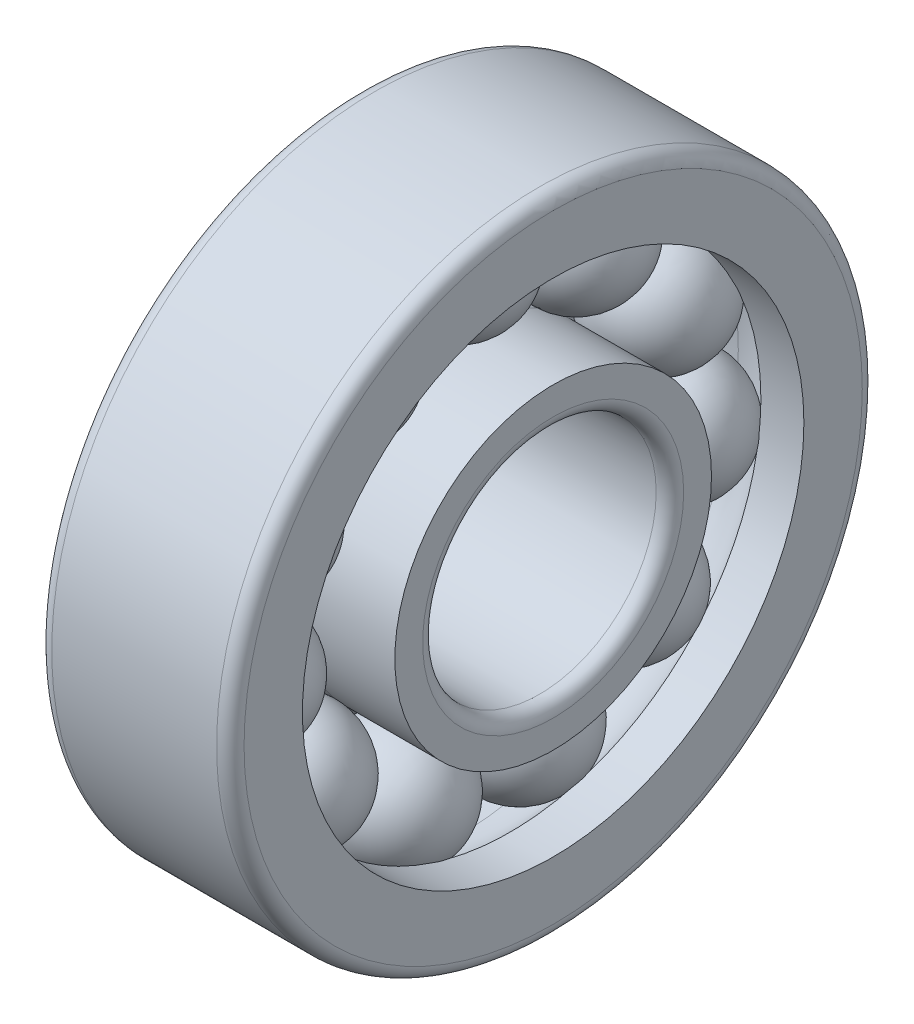
from build123d import *

# Parameters (mm, degrees)
CAGSPISKE_W         = 2.25
CAGSPISKE_H         = 1.5
CAGESPINE_ANGLE     = 0.001
BALLSDETAILED_COUNT = 11
BALLSDETAILED_ANGLE = 327.272727273


with BuildPart() as part:
    # CagSpiSke → CageSpine (revolve)
    with BuildSketch(Plane.XY):
        with Locations((0, 16)):
            Rectangle(CAGSPISKE_W, CAGSPISKE_H)
    revolve(axis=Axis((-20.6375, 0, 0), (1, 0, 0)), revolution_arc=CAGESPINE_ANGLE)

    # BalDetSke → BallDetailed (revolve)
    with BuildSketch(Plane.XY):
        with BuildLine():
            Line((-4.5, 16), (4.5, 16))
            ThreePointArc((4.5, 16), (0, 11.5), (-4.5, 16))
        make_face()
    balldetailed = revolve(axis=Axis((-1.905, 16, 0), (1, 0, 0)))

    # InnRacSke → InnerRace (revolve)
    with BuildSketch(Plane.XY):
        with BuildLine():
            Line((-3.868219875, 13.75), (-7, 13.75))
            Line((-7, 13.75), (-7, 9.5))
            ThreePointArc((-7, 9.5), (-6.707106781, 8.792893219), (-6, 8.5))
            Line((-6, 8.5), (6, 8.5))
            ThreePointArc((6, 8.5), (6.707106781, 8.792893219), (7, 9.5))
            Line((7, 9.5), (7, 11.525))
            Line((7, 11.525), (0, 11.525))
            ThreePointArc((0, 11.525), (-2.231241246, 12.120929557), (-3.868219875, 13.75))
        make_face()
    revolve(axis=Axis((-20.6375, 0, 0), (1, 0, 0)))

    # OutRacSke → OuterRace (revolve)
    with BuildSketch(Plane.XY):
        with BuildLine():
            Line((0, 20.475), (-7, 20.475))
            Line((-7, 20.475), (-7, 22.5))
            ThreePointArc((-7, 22.5), (-6.707106781, 23.207106781), (-6, 23.5))
            Line((-6, 23.5), (6, 23.5))
            ThreePointArc((6, 23.5), (6.707106781, 23.207106781), (7, 22.5))
            Line((7, 22.5), (7, 18.25))
            Line((7, 18.25), (3.868219875, 18.25))
            ThreePointArc((3.868219875, 18.25), (2.231241246, 19.879070443), (0, 20.475))
        make_face()
    revolve(axis=Axis((-20.6375, 0, 0), (1, 0, 0)))

    # BallsDetailed: BallDetailed ×11 about axis
    ballsdetailed_axis = Axis((-50, 0, 0), (1, 0, 0))
    for i in range(1, BALLSDETAILED_COUNT):
        add(balldetailed.rotate(ballsdetailed_axis, i * BALLSDETAILED_ANGLE / (BALLSDETAILED_COUNT - 1)))


solid = part.part
